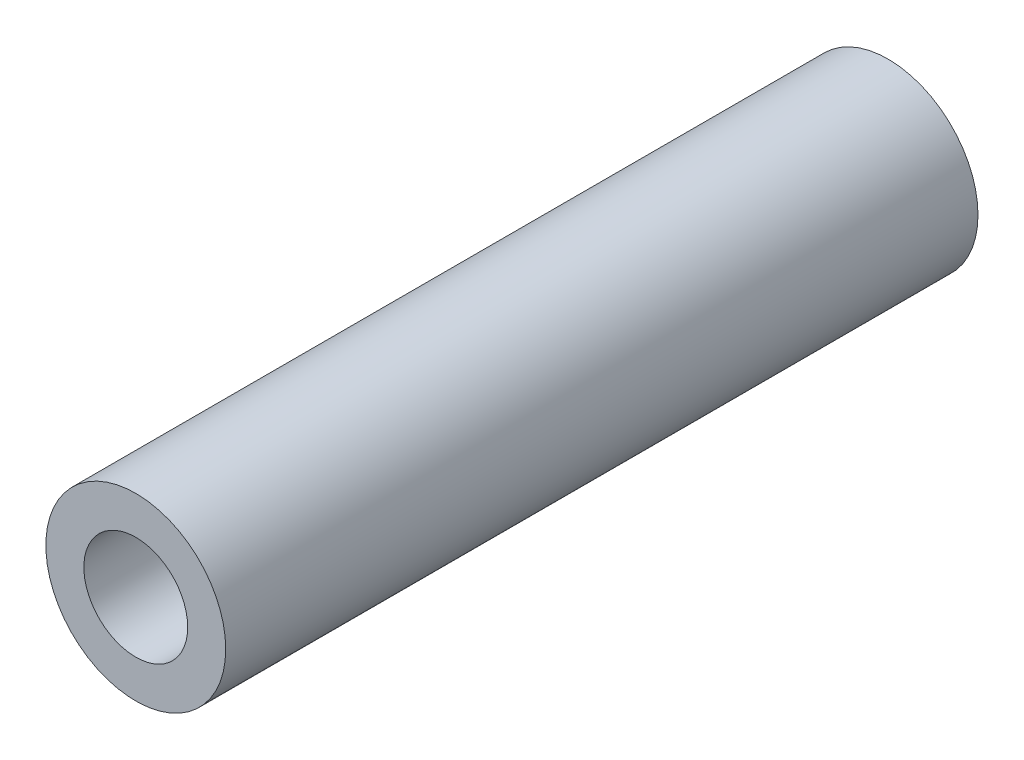
from build123d import *

# Parameters (mm, degrees)
SKETCH1_R           = 5.5
SKETCH1_R_2         = 3.175
BOSS_EXTRUDE1_DEPTH = 23


with BuildPart() as part:
    # Sketch1 → Boss-Extrude1 (new, symmetric)
    with BuildSketch(Plane.XY):
        Circle(SKETCH1_R)
        Circle(SKETCH1_R_2, mode=Mode.SUBTRACT)
    extrude(amount=BOSS_EXTRUDE1_DEPTH, both=True)


solid = part.part
